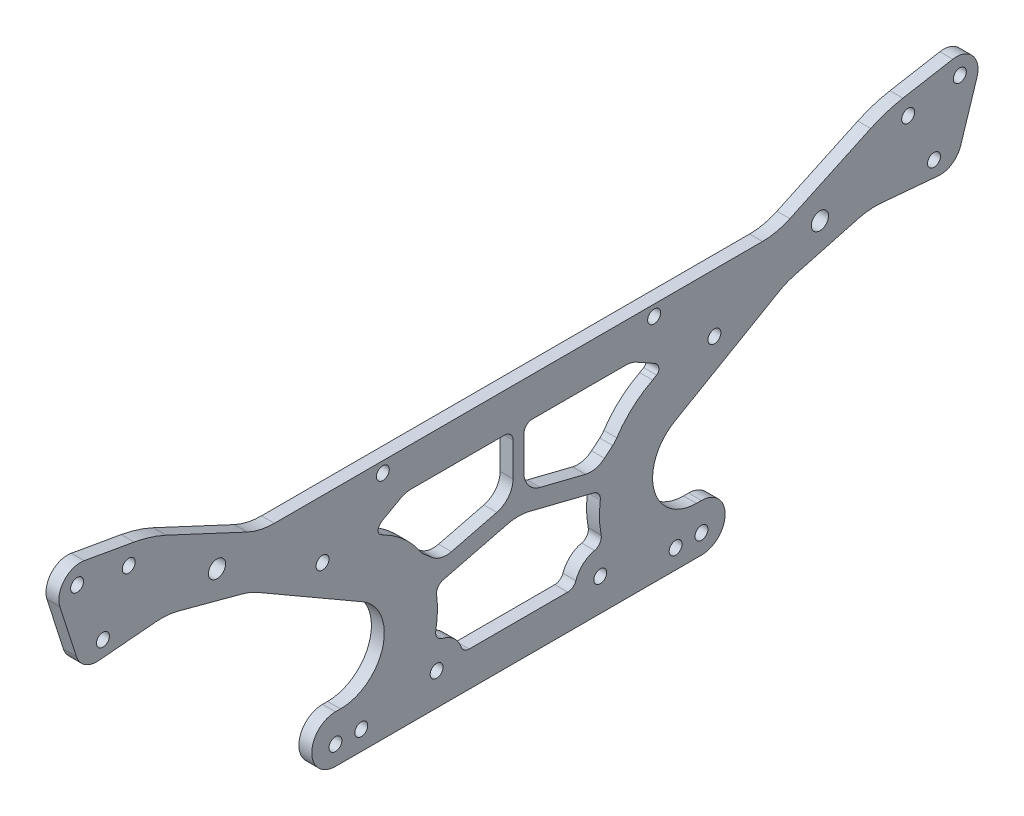
from build123d import *

# Parameters (mm, degrees)
SKETCH1_R           = 1.5
SKETCH1_R_2         = 2
BOSS_EXTRUDE1_DEPTH = 3
FILLET1_R           = 5
FILLET2_R           = 10
FILLET3_R           = 2
FILLET4_R           = 5
FILLET5_R           = 2
FILLET6_R           = 5
FILLET7_R           = 15
FILLET8_R           = 15
FILLET9_R           = 30
FILLET10_R          = 5
BOSS_EXTRUDE2_DEPTH = 3
CUT_EXTRUDE1_DEPTH  = 3


with BuildPart() as part:
    # Sketch1 → Boss-Extrude1 (new body)
    with BuildSketch(Plane(origin=(0, 0, 0), x_dir=(0, 0, -1), z_dir=(1, 0, 0))):
        with BuildLine():
            Line((-42.5, 0), (42.5, 0))
            ThreePointArc((42.5, 0), (48, 5.5), (42.5, 11))
            Line((42.5, 11), (41.335123714, 11))
            ThreePointArc((41.335123714, 11), (31.5, 18.546755856), (36.244089058, 30))
            Line((36.244089058, 30), (62.224851171, 45))
            Line((62.224851171, 45), (81.543367697, 50.176380902))
            Line((81.543367697, 50.176380902), (101.467261659, 48.433266047))
            Line((101.467261659, 48.433266047), (109.012004109, 72.000867593))
            Line((109.012004109, 72.000867593), (85.376618037, 67.833311329))
            Line((85.376618037, 67.833311329), (60, 56))
            Line((60, 56), (-60, 56))
            Line((-60, 56), (-85.376618037, 67.833311329))
            Line((-85.376618037, 67.833311329), (-109.012004109, 72.000867593))
            Line((-109.012004109, 72.000867593), (-101.467261659, 48.433266047))
            Line((-101.467261659, 48.433266047), (-81.543367697, 50.176380902))
            Line((-81.543367697, 50.176380902), (-62.224851171, 45))
            Line((-62.224851171, 45), (-36.244089058, 30))
            ThreePointArc((-36.244089058, 30), (-31.5, 18.546755856), (-41.335123714, 11))
            Line((-41.335123714, 11), (-42.5, 11))
            ThreePointArc((-42.5, 11), (-48, 5.5), (-42.5, 0))
        make_face()
        with Locations((31.5, 53.5)):
            Circle(SKETCH1_R, mode=Mode.SUBTRACT)
        with Locations((45.5, 42.5)):
            Circle(SKETCH1_R, mode=Mode.SUBTRACT)
        with Locations((70, 53.5)):
            Circle(SKETCH1_R_2, mode=Mode.SUBTRACT)
        with Locations((90.5, 64.384076231)):
            Circle(SKETCH1_R, mode=Mode.SUBTRACT)
        with Locations((102.5, 66.5)):
            Circle(SKETCH1_R, mode=Mode.SUBTRACT)
        with Locations((96.5, 52.5)):
            Circle(SKETCH1_R, mode=Mode.SUBTRACT)
        with Locations((42.5, 4.5)):
            Circle(SKETCH1_R, mode=Mode.SUBTRACT)
        with Locations((36.5, 4.5)):
            Circle(SKETCH1_R, mode=Mode.SUBTRACT)
        with Locations((19, 7.5)):
            Circle(SKETCH1_R, mode=Mode.SUBTRACT)
        with Locations((-36.5, 4.5)):
            Circle(SKETCH1_R, mode=Mode.SUBTRACT)
        with Locations((-42.5, 4.5)):
            Circle(SKETCH1_R, mode=Mode.SUBTRACT)
        with Locations((-96.5, 52.5)):
            Circle(SKETCH1_R, mode=Mode.SUBTRACT)
        with Locations((-102.5, 66.5)):
            Circle(SKETCH1_R, mode=Mode.SUBTRACT)
        with Locations((-90.5, 64.384076231)):
            Circle(SKETCH1_R, mode=Mode.SUBTRACT)
        with Locations((-70, 53.5)):
            Circle(SKETCH1_R_2, mode=Mode.SUBTRACT)
        with Locations((-45.5, 42.5)):
            Circle(SKETCH1_R, mode=Mode.SUBTRACT)
        with Locations((-31.5, 53.5)):
            Circle(SKETCH1_R, mode=Mode.SUBTRACT)
        with Locations((-19, 7.5)):
            Circle(SKETCH1_R, mode=Mode.SUBTRACT)
        with BuildLine():
            Line((18.022110342, 29.115638387), (1.25, 33.310573815))
            Line((1.25, 33.310573815), (1.25, 47))
            Line((1.25, 47), (26.25, 47))
            Line((26.25, 47), (34.109043647, 42.61417819))
            Line((34.109043647, 42.61417819), (33.125793941, 41.789133724))
            ThreePointArc((33.125793941, 41.789133724), (27.076764403, 38.174520246), (22.46666207, 32.845060102))
            Line((22.46666207, 32.845060102), (18.022110342, 29.115638387))
        make_face(mode=Mode.SUBTRACT)
        with BuildLine():
            Line((-18.022110342, 29.115638387), (-22.46666207, 32.845060102))
            ThreePointArc((-22.46666207, 32.845060102), (-27.076764403, 38.174520246), (-33.125793941, 41.789133724))
            Line((-33.125793941, 41.789133724), (-34.109043647, 42.61417819))
            Line((-34.109043647, 42.61417819), (-26.25, 47))
            Line((-26.25, 47), (-1.25, 47))
            Line((-1.25, 47), (-1.25, 33.310573815))
            Line((-1.25, 33.310573815), (-18.022110342, 29.115638387))
        make_face(mode=Mode.SUBTRACT)
        with BuildLine():
            Line((-13.030075377, 8.1), (13.030075377, 8.1))
            ThreePointArc((13.030075377, 8.1), (15.257332965, 12.189610161), (19.739088719, 13.454304986))
            ThreePointArc((19.739088719, 13.454304986), (18.820952742, 18.98346387), (19.311633684, 24.566814463))
            Line((19.311633684, 24.566814463), (0, 29.3969196))
            Line((0, 29.3969196), (-19.311633684, 24.566814463))
            ThreePointArc((-19.311633684, 24.566814463), (-18.820952742, 18.98346387), (-19.739088719, 13.454304986))
            ThreePointArc((-19.739088719, 13.454304986), (-15.257332965, 12.189610161), (-13.030075377, 8.1))
        make_face(mode=Mode.SUBTRACT)
    extrude(amount=BOSS_EXTRUDE1_DEPTH)

    # Fillet1
    fillet1_edges = [part.edges().sort_by_distance(p)[0] for p in [
        (1.5, 29.115638387, 18.022110342),
        (1.5, 32.845060102, 22.46666207),
    ]]
    fillet(fillet1_edges, radius=FILLET1_R)

    # Fillet2
    fillet2_edges = [part.edges().sort_by_distance(p)[0] for p in [
        (1.5, 29.3969196, 0),
    ]]
    fillet(fillet2_edges, radius=FILLET2_R)

    # Fillet3
    fillet3_edges = [part.edges().sort_by_distance(p)[0] for p in [
        (1.5, 8.1, -13.030075377),
        (1.5, 13.454304986, -19.739088719),
        (1.5, 24.566814463, -19.311633684),
        (1.5, 24.566814463, 19.311633684),
        (1.5, 13.454304986, 19.739088719),
        (1.5, 8.1, 13.030075377),
    ]]
    fillet(fillet3_edges, radius=FILLET3_R)

    # Fillet4
    fillet4_edges = [part.edges().sort_by_distance(p)[0] for p in [
        (1.5, 33.310573815, 1.25),
    ]]
    fillet(fillet4_edges, radius=FILLET4_R)

    # Fillet5
    fillet5_edges = [part.edges().sort_by_distance(p)[0] for p in [
        (1.5, 47, 1.25),
    ]]
    fillet(fillet5_edges, radius=FILLET5_R)

    # Fillet6
    fillet6_edges = [part.edges().sort_by_distance(p)[0] for p in [
        (1.5, 47, 26.25),
    ]]
    fillet(fillet6_edges, radius=FILLET6_R)

    # Fillet7
    fillet7_edges = [part.edges().sort_by_distance(p)[0] for p in [
        (1.5, 45, 62.224851171),
    ]]
    fillet(fillet7_edges, radius=FILLET7_R)

    # Fillet8
    fillet8_edges = [part.edges().sort_by_distance(p)[0] for p in [
        (1.5, 50.176380902, 81.543367697),
        (1.5, 56, 60),
    ]]
    fillet(fillet8_edges, radius=FILLET8_R)

    # Fillet9
    fillet9_edges = [part.edges().sort_by_distance(p)[0] for p in [
        (1.5, 67.833311329, 85.376618037),
    ]]
    fillet(fillet9_edges, radius=FILLET9_R)

    # Fillet10
    fillet10_edges = [part.edges().sort_by_distance(p)[0] for p in [
        (1.5, 48.433266047, 101.467261659),
        (1.5, 72.000867593, 109.012004109),
    ]]
    fillet(fillet10_edges, radius=FILLET10_R)

    # Sketch2 → Boss-Extrude2 (add)
    with BuildSketch(Plane.ZY):
        Polygon((34.109043647, 42.61417819), (31.155122873, 40.890234672), (35.435126155, 42.486892898), align=None)
    extrude(amount=-BOSS_EXTRUDE2_DEPTH)

    # Fillet11
    # an asymmetric fillet: 2, 1 mm, written as the material it adds along each edge
    with BuildSketch(Plane(origin=(0, 42.61417819, 34.109043647), x_dir=(0, 0.4873135344398375, -0.8732270719301786), z_dir=(1, 0, 0))) as fillet11_piece_1:
        with BuildLine():
            Bezier((2.913430357, 0), (0, 0), (1.191368957, -2.01710596), weights=[1, 0.495705063, 1])
            Line((1.191368957, -2.01710596), (0, 0))
            Line((0, 0), (2.913430357, 0))
        make_face()
    extrude(amount=3)

    # Sketch3 → Cut-Extrude1 (cut)
    with BuildSketch(Plane.ZY):
        Polygon((0, 0), (0, 75.071953776), (-134.912211469, 75.071953776), (-134.912211469, -12.246363453), align=None)
    extrude(amount=-CUT_EXTRUDE1_DEPTH, mode=Mode.SUBTRACT)

    # Mirror3: part across plane


with BuildPart() as part_1:
    add(part.part)
    add(part.part.mirror(Plane.XY))


solid = part_1.part
